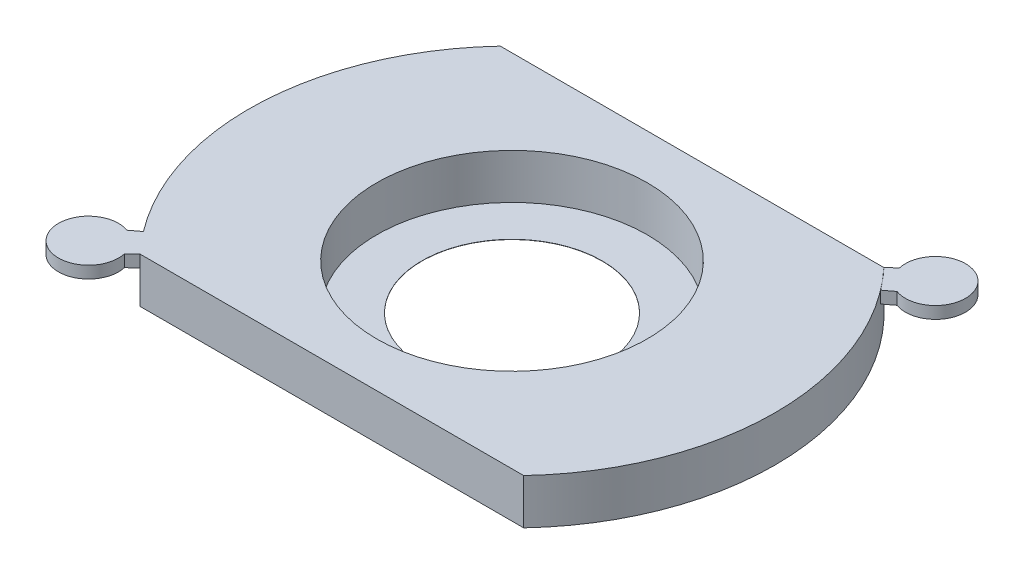
from build123d import *

# Parameters (mm, degrees)
SKETCH1_R                = 1750
BOSS_EXTRUDE1_DEPTH      = 500
SKETCH2_R                = 900
CUT_EXTRUDE2_DEPTH       = 300
CUT_EXTRUDE10_DEPTH      = 2525.876234591
CUT_EXTRUDE10_DEPTH_BACK = 2525.876234591
SKETCH9_W                = 5273.235769222
SKETCH9_H                = 4165.824449254
SKETCH9_W_2              = 4212.623718326
SKETCH9_H_2              = 2396.11984
SKETCH3_R                = 600
CUT_EXTRUDE3_DEPTH       = 300
SHELL1_T                 = -1.5
SKETCH10_W               = 4453.085199548
SKETCH10_H               = 3102.078328882
CUT_EXTRUDE11_DEPTH      = 2143.136742113
BOSS_EXTRUDE2_START      = -80
BOSS_EXTRUDE2_DEPTH      = 80
BOSS_EXTRUDE3_DEPTH      = 80


with BuildPart() as part:
    # Sketch1 → Boss-Extrude1 (new body)
    with BuildSketch(Plane(origin=(0, 0, 0), x_dir=(1, 0, 0), z_dir=(0, 1, 0))):
        Circle(SKETCH1_R)
    extrude(amount=BOSS_EXTRUDE1_DEPTH)

    # Sketch2 → Cut-Extrude2 (cut)
    with BuildSketch(Plane(origin=(0, 500, 0), x_dir=(1, 0, 0), z_dir=(0, 1, 0))):
        Circle(SKETCH2_R)
    extrude(amount=-CUT_EXTRUDE2_DEPTH, mode=Mode.SUBTRACT)

    # Sketch9 → Cut-Extrude10 (cut, two sides: drawn at the far end of the back side and taken through both)
    with BuildSketch(Plane.XZ.offset(-CUT_EXTRUDE10_DEPTH_BACK)):
        Rectangle(SKETCH9_W, SKETCH9_H)
        Rectangle(SKETCH9_W_2, SKETCH9_H_2, mode=Mode.SUBTRACT)
    extrude(amount=CUT_EXTRUDE10_DEPTH + CUT_EXTRUDE10_DEPTH_BACK, mode=Mode.SUBTRACT)

    # Sketch3 → Cut-Extrude3 (cut)
    with BuildSketch(Plane.XZ):
        Circle(SKETCH3_R)
    extrude(amount=-CUT_EXTRUDE3_DEPTH, mode=Mode.SUBTRACT)

    # Shell1
    shell1_openings = [part.faces().sort_by_distance(p)[0] for p in [
        (1707.583740986, 0, 0),
    ]]
    offset(amount=SHELL1_T, openings=shell1_openings, kind=Kind.INTERSECTION)

    # Sketch10 → Cut-Extrude11 (cut, through all)
    with BuildSketch(Plane.XZ.offset(-198.5)):
        Rectangle(SKETCH10_W, SKETCH10_H)
    extrude(amount=CUT_EXTRUDE11_DEPTH, mode=Mode.SUBTRACT)

    # Sketch12 → Boss-Extrude2 (add)
    with BuildSketch(Plane(origin=(0, 500, 0), x_dir=(1, 0, 0), z_dir=(0, 1, 0)).offset(BOSS_EXTRUDE2_START)):
        with BuildLine():
            Line((-1329.427366657, -1248.362496346), (-1275.720428066, -1197.93046101))
            ThreePointArc((-1275.720428066, -1197.93046101), (-1337.090701529, -1129.021016582), (-1394.743394808, -1056.972498526))
            Line((-1394.743394808, -1056.972498526), (-1456.886660309, -1104.066267063))
            ThreePointArc((-1456.886660309, -1104.066267063), (-1674.443216413, -1424.679230146), (-1329.427366657, -1248.362496346))
        make_face()
    extrude(amount=BOSS_EXTRUDE2_DEPTH)


with BuildPart() as body_2:
    # Sketch12<6> → Boss-Extrude3 (new body)
    with BuildSketch(Plane(origin=(0, 500, 0), x_dir=(1, 0, 0), z_dir=(0, 1, 0))):
        with BuildLine():
            Line((1329.427366657, 1248.362496346), (1275.858293729, 1198.05992))
            ThreePointArc((1275.858293729, 1198.05992), (1337.197472539, 1129.114373304), (1394.743394808, 1056.972498526))
            Line((1394.743394808, 1056.972498526), (1456.886660309, 1104.066267063))
            ThreePointArc((1456.886660309, 1104.066267063), (1674.443216413, 1424.679230146), (1329.427366657, 1248.362496346))
        make_face()
    extrude(amount=-BOSS_EXTRUDE3_DEPTH)


solid = Compound([part.part, body_2.part])
